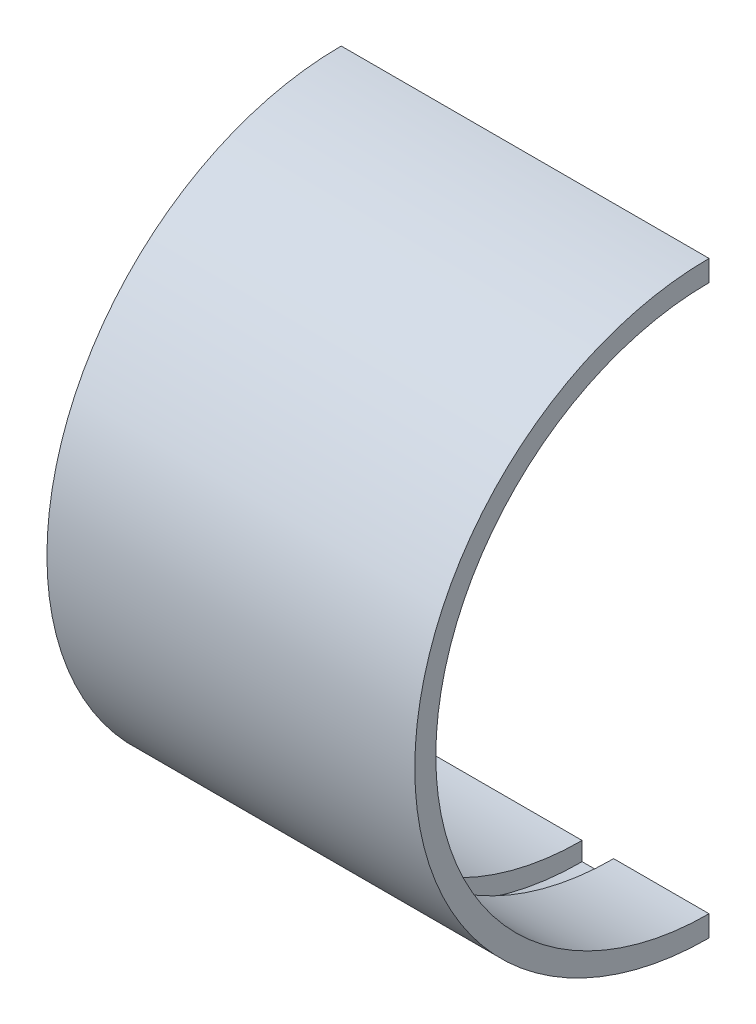
from build123d import *

# Parameters (mm, degrees)
BOSS_EXTRUDE1_DEPTH = 889
CAVITY1_START       = 582.248938238
CAVITY1_DEPTH       = 76.2


# Read off the part's stored shape, not the designer's step: Cavity1
with BuildPart() as part:
    # Sketch1 → Boss-Extrude1 (new body)
    with BuildSketch(Plane(origin=(0, 0, 0), x_dir=(0, 0, -1), z_dir=(1, 0, 0))):
        with BuildLine():
            Line((0, 711.2), (0, 660.4))
            ThreePointArc((0, 660.4), (-660.4, 0), (0, -660.4))
            Line((0, -660.4), (0, -711.2))
            ThreePointArc((0, -711.2), (-711.2, 0), (0, 711.2))
        make_face()
    extrude(amount=BOSS_EXTRUDE1_DEPTH)

    # Cavity1 outline → Cavity1 (cut)
    with BuildSketch(Plane.YZ.offset(CAVITY1_START)):
        with BuildLine():
            ThreePointArc((704.85, 0), (0, 704.85), (-704.85, 0))
            Line((-704.85, 0), (-660.4, 0))
            ThreePointArc((-660.4, 0), (0, 660.4), (660.4, 0))
            Line((660.4, 0), (704.85, 0))
        make_face()
    extrude(amount=CAVITY1_DEPTH, mode=Mode.SUBTRACT)


solid = part.part
